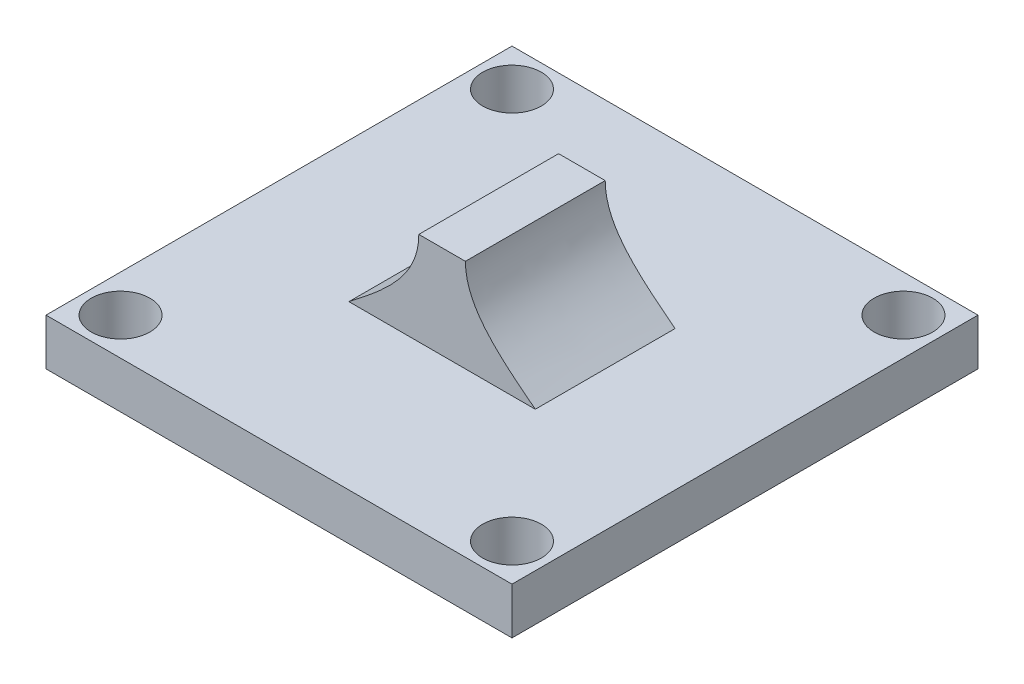
from build123d import *

# Parameters (mm, degrees)
SKETCH1_W           = 50
SKETCH1_H           = 50
BOSS_EXTRUDE1_DEPTH = 5
LOFT1_START         = -7.5
LOFT1_DEPTH         = 15
SKETCH7_R           = 3.15
CUT_EXTRUDE1_DEPTH  = 39.405728778


# Read off the part's stored shape, not the designer's step: Loft1
with BuildPart() as part:
    # Sketch1 → Boss-Extrude1 (new body)
    with BuildSketch(Plane(origin=(0, 0, 0), x_dir=(1, 0, 0), z_dir=(0, 1, 0))):
        Rectangle(SKETCH1_W, SKETCH1_H)
    extrude(amount=BOSS_EXTRUDE1_DEPTH)

    # Loft1 outline → Loft1 (add)
    with BuildSketch(Plane.XY.offset(LOFT1_START)):
        with BuildLine():
            add(Edge.make_bspline(
                [(2.5, 15), (2.5, 10.833333333), (6.25, 7.916666667), (10, 5)],
                knots=[0, 0, 0, 0, 1, 1, 1, 1], degree=3))
            Line((2.5, 15), (-2.5, 15))
            add(Edge.make_bspline(
                [(-2.5, 15), (-2.5, 10.833333333), (-6.25, 7.916666667), (-10, 5)],
                knots=[0, 0, 0, 0, 1, 1, 1, 1], degree=3))
            Line((-10, 5), (10, 5))
        make_face()
    extrude(amount=LOFT1_DEPTH)

    # Sketch7 → Cut-Extrude1 (cut, through all)
    with BuildSketch(Plane(origin=(0, 0, 0), x_dir=(-1, 0, 0), z_dir=(0, -1, 0))):
        with Locations(Location((21, -21, 0), (0, 0, 90))):
            Circle(SKETCH7_R)
        with Locations(Location((-21, -21, 0), (0, 0, 90))):
            Circle(SKETCH7_R)
        with Locations(Location((-21, 21, 0), (0, 0, 90))):
            Circle(SKETCH7_R)
        with Locations(Location((21, 21, 0), (0, 0, 90))):
            Circle(SKETCH7_R)
    extrude(amount=-CUT_EXTRUDE1_DEPTH, mode=Mode.SUBTRACT)


solid = part.part
